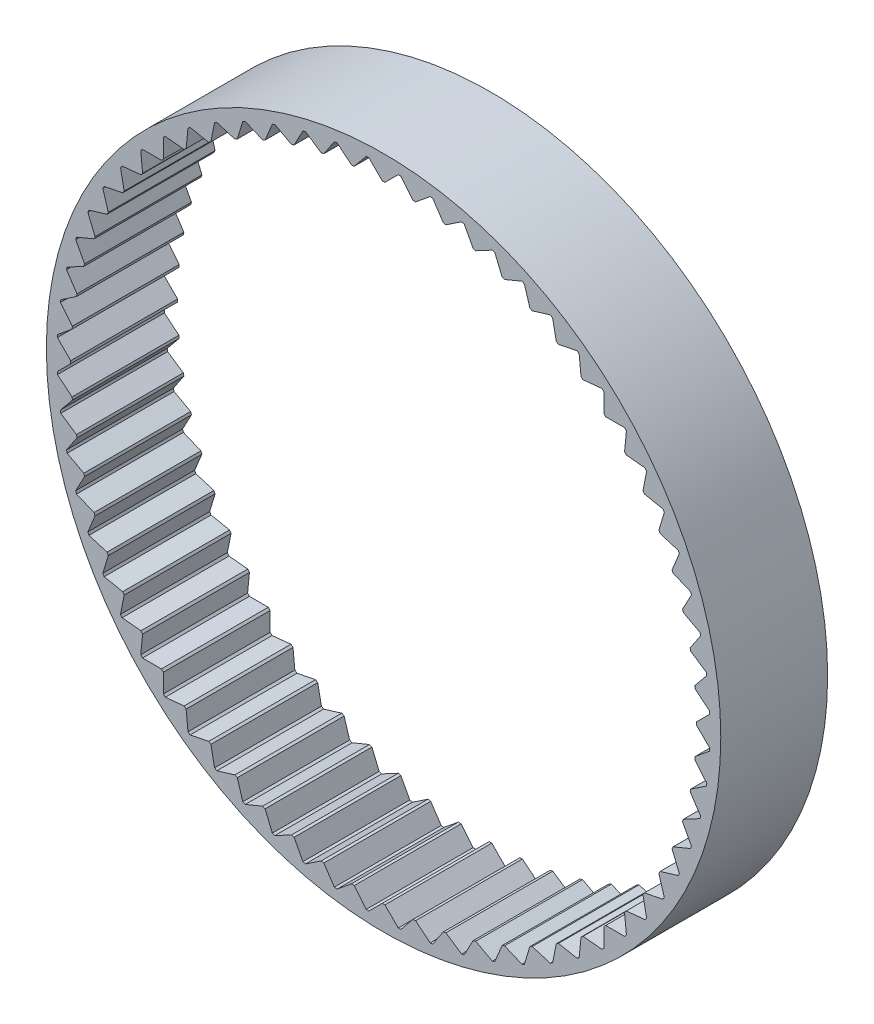
from build123d import *

# Parameters (mm, degrees)
SKETCH1_R           = 63.115498147
SKETCH1_R_2         = 61.115498147
BOSS_EXTRUDE1_DEPTH = 20
BOSS_EXTRUDE2_DEPTH = 20
CIRPATTERN1_COUNT   = 64


with BuildPart() as part:
    # Sketch1 → Boss-Extrude1 (new body)
    with BuildSketch(Plane.XY):
        Circle(SKETCH1_R)
        Circle(SKETCH1_R_2, mode=Mode.SUBTRACT)
    extrude(amount=BOSS_EXTRUDE1_DEPTH)

    # Sketch2 → Boss-Extrude2 (add)
    with BuildSketch(Plane(origin=(0, 0, 0), x_dir=(-1, 0, 0), z_dir=(0, 0, -1))):
        with BuildLine():
            Line((-2.749072102, 61.053638027), (-0.249072102, 58.553638027))
            Line((-0.249072102, 58.553638027), (0.249072102, 58.553638027))
            Line((0.249072102, 58.553638027), (2.749072102, 61.053638027))
            ThreePointArc((2.749072102, 61.053638027), (0, 61.115498147), (-2.749072102, 61.053638027))
        make_face()
    boss_extrude2 = extrude(amount=-BOSS_EXTRUDE2_DEPTH)

    # CirPattern1: Boss-Extrude2 ×64 about axis
    cirpattern1_axis = Axis((0, 0, 0), (0, 0, 1))
    for i in range(1, CIRPATTERN1_COUNT):
        add(boss_extrude2.rotate(cirpattern1_axis, i * 360 / CIRPATTERN1_COUNT))


solid = part.part
